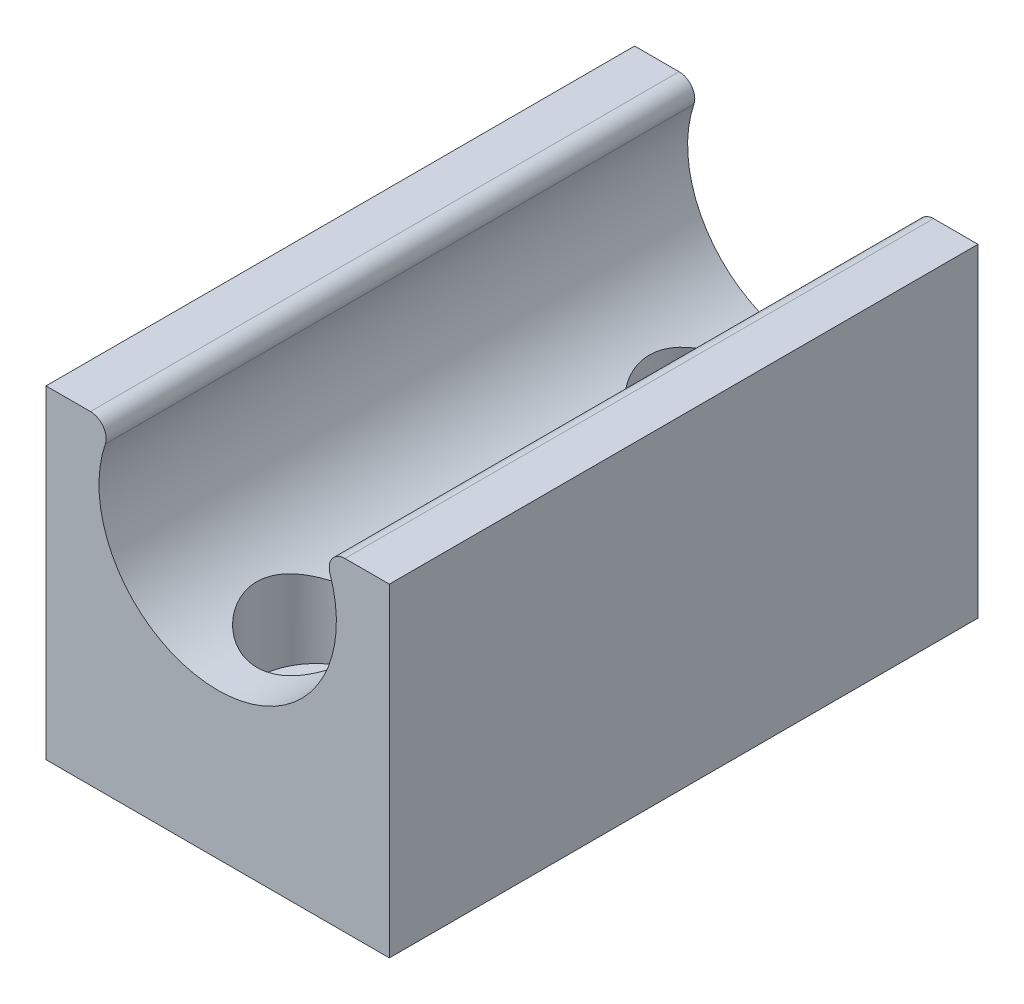
from build123d import *

# Parameters (mm, degrees)
BOSS_EXTRUDE1_DEPTH = 30
FILLET1_R           = 0.8
SKETCH3_R           = 3
CUT_EXTRUDE1_DEPTH  = 12.5
SKETCH4_R           = 1.55
CUT_EXTRUDE2_DEPTH  = 36.338541368


with BuildPart() as part:
    # Sketch1 → Boss-Extrude1 (new body)
    with BuildSketch(Plane.XY):
        with BuildLine():
            Line((-5.25, 8.25), (-8.75, 8.25))
            Line((-8.75, 8.25), (-8.75, -8.25))
            Line((-8.75, -8.25), (8.75, -8.25))
            Line((8.75, -8.25), (8.75, 8.25))
            Line((8.75, 8.25), (5.25, 8.25))
            ThreePointArc((5.25, 8.25), (0, -0.806659276), (-5.25, 8.25))
        make_face()
    extrude(amount=BOSS_EXTRUDE1_DEPTH)

    # Fillet1
    fillet1_edges = [part.edges().sort_by_distance(p)[0] for p in [
        (5.25, 8.25, 15),
        (-5.25, 8.25, 15),
    ]]
    fillet(fillet1_edges, radius=FILLET1_R)

    # Sketch3 → Cut-Extrude1 (cut)
    with BuildSketch(Plane(origin=(0, 8.25, 0), x_dir=(1, 0, 0), z_dir=(0, 1, 0))):
        with Locations((0, -5)):
            Circle(SKETCH3_R)
        with Locations((0, -25)):
            Circle(SKETCH3_R)
    extrude(amount=-CUT_EXTRUDE1_DEPTH, mode=Mode.SUBTRACT)

    # Sketch4 → Cut-Extrude2 (cut, through all)
    with BuildSketch(Plane(origin=(0, 8.25, 0), x_dir=(1, 0, 0), z_dir=(0, 1, 0))):
        with Locations((0, -5)):
            Circle(SKETCH4_R)
        with Locations((0, -25)):
            Circle(SKETCH4_R)
    extrude(amount=-CUT_EXTRUDE2_DEPTH, mode=Mode.SUBTRACT)


solid = part.part
